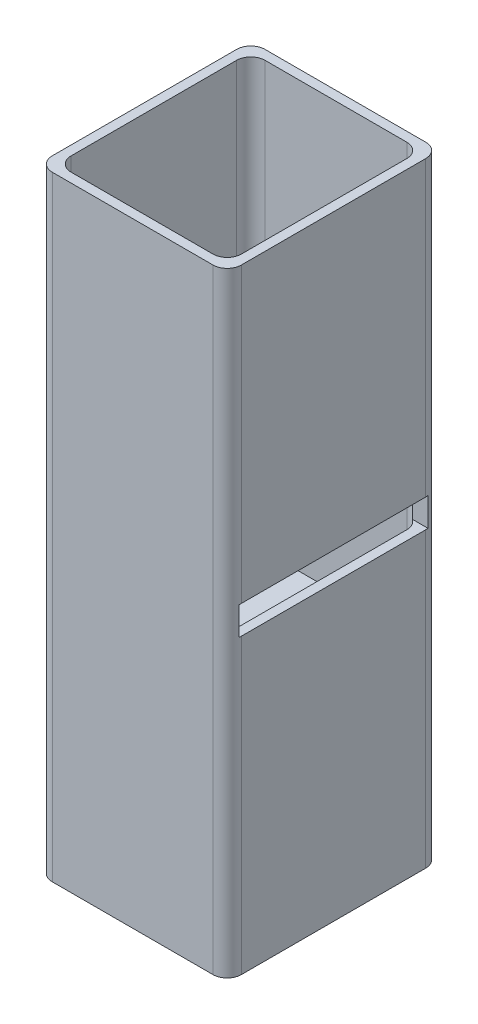
from build123d import *

# Parameters (mm, degrees)
SKETCH2_W              = 40
SKETCH2_H              = 45
BOSS_EXTRUDE1_DEPTH    = 80
SKETCH3_R              = 10.75
CUT_EXTRUDE1_DEPTH     = 20
SKETCH5_W              = 36
SKETCH5_H              = 41
CUT_EXTRUDE2_DEPTH     = 40
SKETCH6_R              = 5
CUT_EXTRUDE3_DEPTH     = 100
SKETCH7_W              = 40
SKETCH7_H              = 6
CUT_EXTRUDE4_DEPTH     = 10
FILLET1_R              = 3
FILLET2_R              = 3
FILLET3_R              = 3
FILLET4_R              = 3
FILLET5_R              = 3
FILLET6_R              = 3
SPLIT1_SURFACE_1_BACK  = 101.125
SPLIT1_SURFACE_1_DEPTH = 202.25
SPLIT1_SURFACE_2_BACK  = 101.125
SPLIT1_SURFACE_2_DEPTH = 202.25
SKETCH10_R             = 8.1
SKETCH10_R_2           = 7.85
BOSS_EXTRUDE2_DEPTH    = 5
BOSS_EXTRUDE6_DEPTH    = 2
BOSS_EXTRUDE3_DEPTH    = 50


with BuildPart() as part:
    # Sketch2 → Boss-Extrude1 (new body)
    with BuildSketch(Plane(origin=(0, 0, 0), x_dir=(1, 0, 0), z_dir=(0, 1, 0))):
        Rectangle(SKETCH2_W, SKETCH2_H)
    extrude(amount=BOSS_EXTRUDE1_DEPTH)

    # Sketch3 → Cut-Extrude1 (cut)
    with BuildSketch(Plane.XZ):
        with Locations(Location((0, 0, 0), (0, 0, 270))):
            Circle(SKETCH3_R)
    extrude(amount=-CUT_EXTRUDE1_DEPTH, mode=Mode.SUBTRACT)

    # Sketch5 → Cut-Extrude2 (cut)
    with BuildSketch(Plane(origin=(0, 80, 0), x_dir=(1, 0, 0), z_dir=(0, 1, 0))):
        Rectangle(SKETCH5_W, SKETCH5_H)
    extrude(amount=-CUT_EXTRUDE2_DEPTH, mode=Mode.SUBTRACT)

    # Sketch6 → Cut-Extrude3 (cut)
    with BuildSketch(Plane.XZ.offset(-20)):
        with Locations(Location((0, 0, 0), (0, 0, 270))):
            Circle(SKETCH6_R)
    extrude(amount=-CUT_EXTRUDE3_DEPTH, mode=Mode.SUBTRACT)

    # Sketch7 → Cut-Extrude4 (cut)
    with BuildSketch(Plane(origin=(20, 0, 0), x_dir=(0, 0, -1), z_dir=(1, 0, 0))):
        with Locations((0, 65)):
            Rectangle(SKETCH7_W, SKETCH7_H)
    extrude(amount=-CUT_EXTRUDE4_DEPTH, mode=Mode.SUBTRACT)

    # Fillet1
    # the kernel refuses this fillet: 3 mm, written as the material it takes off along each edge
    with BuildSketch(Plane(origin=(20, -7.5, 22.5), x_dir=(0, 0, -1), z_dir=(0, 1, 0)), Plane(origin=(20, -7.5, -22.5), x_dir=(-1, 0, 0), z_dir=(0, 1, 0))) as fillet1_piece_1:
        with BuildLine():
            CenterArc((FILLET1_R, FILLET1_R), FILLET1_R, 180, 90)
            Line((0, FILLET1_R), (0, 0))
            Line((0, 0), (FILLET1_R, 0))
        make_face()
    extrude(amount=95, mode=Mode.SUBTRACT)

    # Fillet2
    fillet2_edges = [part.edges().sort_by_distance(p)[0] for p in [
        (-20, 40, 22.5),
        (-20, 40, -22.5),
    ]]
    fillet(fillet2_edges, radius=FILLET2_R)

    # Fillet3
    fillet3_edges = [part.edges().sort_by_distance(p)[0] for p in [
        (-18, 60, -20.5),
    ]]
    fillet(fillet3_edges, radius=FILLET3_R)

    # Fillet4
    # the kernel refuses this fillet: 3 mm, written as the material it adds along each edge
    with BuildSketch(Plane(origin=(18, 80, -20.5), x_dir=(-1, 0, 0), z_dir=(0, -1, 0))) as fillet4_piece_1_section:
        with BuildLine():
            CenterArc((FILLET4_R, -FILLET4_R), FILLET4_R, 90, 90)
            Line((0, -FILLET4_R), (0, 0))
            Line((0, 0), (FILLET4_R, 0))
        make_face()
    fillet4_piece_1 = extrude(amount=47.5, mode=Mode.PRIVATE)
    fillet4_piece_1 = split(fillet4_piece_1, bisect_by=Plane(origin=(17.022641749, 74, -20), z_dir=(0, 0, -1)), keep=Keep.TOP, mode=Mode.PRIVATE)
    add(fillet4_piece_1)
    with BuildSketch(Plane(origin=(18, 80, -20.5), x_dir=(-1, 0, 0), z_dir=(0, -1, 0))) as fillet4_piece_2_section:
        with BuildLine():
            CenterArc((FILLET4_R, -FILLET4_R), FILLET4_R, 90, 90)
            Line((0, -FILLET4_R), (0, 0))
            Line((0, 0), (FILLET4_R, 0))
        make_face()
    fillet4_piece_2 = extrude(amount=47.5, mode=Mode.PRIVATE)
    fillet4_piece_2 = split(fillet4_piece_2, bisect_by=Plane(origin=(17.619593503, 68, -19.406346205), z_dir=(0, 1, 0)), keep=Keep.TOP, mode=Mode.PRIVATE)
    add(fillet4_piece_2)
    with BuildSketch(Plane(origin=(18, 87.5, -20.5), x_dir=(-1, 0, 0), z_dir=(0, -1, 0))) as fillet4_piece_3_section:
        with BuildLine():
            CenterArc((FILLET4_R, -FILLET4_R), FILLET4_R, 90, 90)
            Line((0, -FILLET4_R), (0, 0))
            Line((0, 0), (FILLET4_R, 0))
        make_face()
    fillet4_piece_3 = extrude(amount=55, mode=Mode.PRIVATE)
    fillet4_piece_3 = split(fillet4_piece_3, bisect_by=Plane(origin=(17.619593503, 62, -19.406346205), z_dir=(0, -1, 0)), keep=Keep.TOP, mode=Mode.PRIVATE)
    add(fillet4_piece_3)

    # Fillet5
    fillet5_edges = [part.edges().sort_by_distance(p)[0] for p in [
        (-18, 60, 20.5),
    ]]
    fillet(fillet5_edges, radius=FILLET5_R)

    # Fillet6
    # the kernel refuses this fillet: 3 mm, written as the material it adds along each edge
    with BuildSketch(Plane(origin=(18, 80, 20.5), x_dir=(-1, 0, 0), z_dir=(0, -1, 0))) as fillet6_piece_1_section:
        with BuildLine():
            CenterArc((FILLET6_R, FILLET6_R), FILLET6_R, 180, 90)
            Line((0, FILLET6_R), (0, 0))
            Line((0, 0), (FILLET6_R, 0))
        make_face()
    fillet6_piece_1 = extrude(amount=47.5, mode=Mode.PRIVATE)
    fillet6_piece_1 = split(fillet6_piece_1, bisect_by=Plane(origin=(17.022641749, 74, 20), z_dir=(0, 0, 1)), keep=Keep.TOP, mode=Mode.PRIVATE)
    add(fillet6_piece_1)
    with BuildSketch(Plane(origin=(18, 80, 20.5), x_dir=(-1, 0, 0), z_dir=(0, -1, 0))) as fillet6_piece_2_section:
        with BuildLine():
            CenterArc((FILLET6_R, FILLET6_R), FILLET6_R, 180, 90)
            Line((0, FILLET6_R), (0, 0))
            Line((0, 0), (FILLET6_R, 0))
        make_face()
    fillet6_piece_2 = extrude(amount=47.5, mode=Mode.PRIVATE)
    fillet6_piece_2 = split(fillet6_piece_2, bisect_by=Plane(origin=(17.619593503, 68, 19.406346205), z_dir=(0, 1, 0)), keep=Keep.TOP, mode=Mode.PRIVATE)
    add(fillet6_piece_2)
    with BuildSketch(Plane(origin=(18, 87.5, 20.5), x_dir=(-1, 0, 0), z_dir=(0, -1, 0))) as fillet6_piece_3_section:
        with BuildLine():
            CenterArc((FILLET6_R, FILLET6_R), FILLET6_R, 180, 90)
            Line((0, FILLET6_R), (0, 0))
            Line((0, 0), (FILLET6_R, 0))
        make_face()
    fillet6_piece_3 = extrude(amount=55, mode=Mode.PRIVATE)
    fillet6_piece_3 = split(fillet6_piece_3, bisect_by=Plane(origin=(17.619593503, 62, 19.406346205), z_dir=(0, -1, 0)), keep=Keep.TOP, mode=Mode.PRIVATE)
    add(fillet6_piece_3)


with BuildPart() as body_2:
    # Split1: the piece behind the surface
    add(part.part)
    # Split1 surface: a surface, the sketch's curves swept straight by 202.25 mm
    with BuildLine(Plane(origin=(0, 80, 0), x_dir=(1, 0, 0), z_dir=(0, 1, 0)).offset(-SPLIT1_SURFACE_1_BACK), mode=Mode.PRIVATE) as split1_surface_1_path:
        Line((0, 22.5), (0, 0))
        Line((0, 0), (0, -22.5))
    split1_surface_1 = Shell.extrude(split1_surface_1_path.wire(), (0 * SPLIT1_SURFACE_1_DEPTH, 1 * SPLIT1_SURFACE_1_DEPTH, 0 * SPLIT1_SURFACE_1_DEPTH))
    split(bisect_by=split1_surface_1, keep=Keep.BOTTOM)


with BuildPart() as part_1:
    add(part.part)

    # Split1: split by a surface, the side it looks to stays
    # Split1 surface: a surface, the sketch's curves swept straight by 202.25 mm
    with BuildLine(Plane(origin=(0, 80, 0), x_dir=(1, 0, 0), z_dir=(0, 1, 0)).offset(-SPLIT1_SURFACE_2_BACK), mode=Mode.PRIVATE) as split1_surface_2_path:
        Line((0, 22.5), (0, 0))
        Line((0, 0), (0, -22.5))
    split1_surface_2 = Shell.extrude(split1_surface_2_path.wire(), (0 * SPLIT1_SURFACE_2_DEPTH, 1 * SPLIT1_SURFACE_2_DEPTH, 0 * SPLIT1_SURFACE_2_DEPTH))
    split(bisect_by=split1_surface_2, keep=Keep.TOP)

    # Sketch10 → Boss-Extrude2 (add)
    # profile 1 of 2: a face of its own
    with BuildSketch(Plane(origin=(0, 40, 0), x_dir=(1, 0, 0), z_dir=(0, 1, 0))):
        with Locations(Location((9.7, 12, 0), (0, 0, 270))):
            Circle(SKETCH10_R)
        with Locations(Location((9.7, 12, 0), (0, 0, 270))):
            Circle(SKETCH10_R_2, mode=Mode.SUBTRACT)
    # profile 2 of 2: a face of its own
    with BuildSketch(Plane(origin=(0, 40, 0), x_dir=(1, 0, 0), z_dir=(0, 1, 0))):
        with Locations(Location((9.7, -12, 0), (0, 0, 270))):
            Circle(SKETCH10_R)
        with Locations(Location((9.7, -12, 0), (0, 0, 270))):
            Circle(SKETCH10_R_2, mode=Mode.SUBTRACT)
    extrude(amount=BOSS_EXTRUDE2_DEPTH)

    add(body_2.part)  # Boss-Extrude3 merges body 2
    # Sketch11 → Boss-Extrude3 (add)
    with BuildSketch(Plane(origin=(0, 80, 0), x_dir=(1, 0, 0), z_dir=(0, 1, 0))):
        with BuildLine():
            Line((-20, 19.5), (-20, -19.5))
            ThreePointArc((-20, -19.5), (-19.121320344, -21.621320344), (-17, -22.5))
            Line((-17, -22.5), (17, -22.5))
            ThreePointArc((17, -22.5), (19.121320344, -21.621320344), (20, -19.5))
            Line((20, -19.5), (20, 19.5))
            ThreePointArc((20, 19.5), (19.121320344, 21.621320344), (17, 22.5))
            Line((17, 22.5), (-17, 22.5))
            ThreePointArc((-17, 22.5), (-19.121320344, 21.621320344), (-20, 19.5))
        make_face()
        with BuildLine():
            Line((-18, 17.5), (-18, -17.5))
            ThreePointArc((-18, -17.5), (-17.121320344, -19.621320344), (-15, -20.5))
            Line((-15, -20.5), (15, -20.5))
            ThreePointArc((15, -20.5), (17.121320344, -19.621320344), (18, -17.5))
            Line((18, -17.5), (18, 17.5))
            ThreePointArc((18, 17.5), (17.121320344, 19.621320344), (15, 20.5))
            Line((15, 20.5), (-15, 20.5))
            ThreePointArc((-15, 20.5), (-17.121320344, 19.621320344), (-18, 17.5))
        make_face(mode=Mode.SUBTRACT)
    extrude(amount=BOSS_EXTRUDE3_DEPTH)


with BuildPart() as body_3:
    # Sketch15 → Boss-Extrude6 (new body)
    with BuildSketch(Plane(origin=(0, 80, 0), x_dir=(1, 0, 0), z_dir=(0, 1, 0))):
        with BuildLine():
            Line((0, 20.5), (0, 5))
            ThreePointArc((0, 5), (3.535533906, 3.535533906), (5, 0))
            Line((5, 0), (18, 0))
            Line((18, 0), (18, 17.5))
            ThreePointArc((18, 17.5), (17.121320344, 19.621320344), (15, 20.5))
            Line((15, 20.5), (0, 20.5))
        make_face()
    extrude(amount=-BOSS_EXTRUDE6_DEPTH)


solid = Compound([part_1.part, body_3.part])
